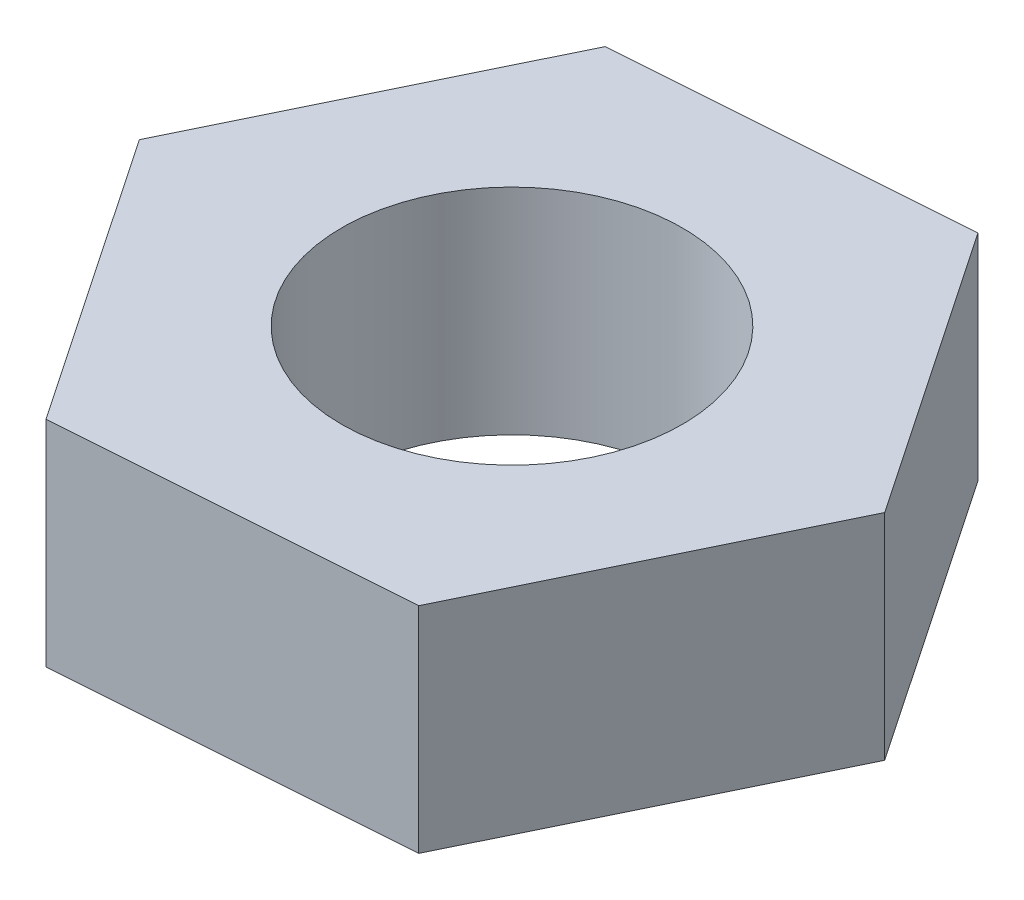
from build123d import *

# Parameters (mm, degrees)
SKETCH1_R           = 6.35
BOSS_EXTRUDE1_DEPTH = 8


with BuildPart() as part:
    # Sketch1 → Boss-Extrude1 (new body)
    with BuildSketch(Plane(origin=(0, 0, 0), x_dir=(1, 0, 0), z_dir=(0, 1, 0))):
        Polygon((7.286973477, -10.765687045), (12.966845208, 0.927860625), (5.679871732, 11.69354767), (-7.286973477, 10.765687045), (-12.966845208, -0.927860625), (-5.679871732, -11.69354767), align=None)
        Circle(SKETCH1_R, mode=Mode.SUBTRACT)
    extrude(amount=BOSS_EXTRUDE1_DEPTH)


solid = part.part
